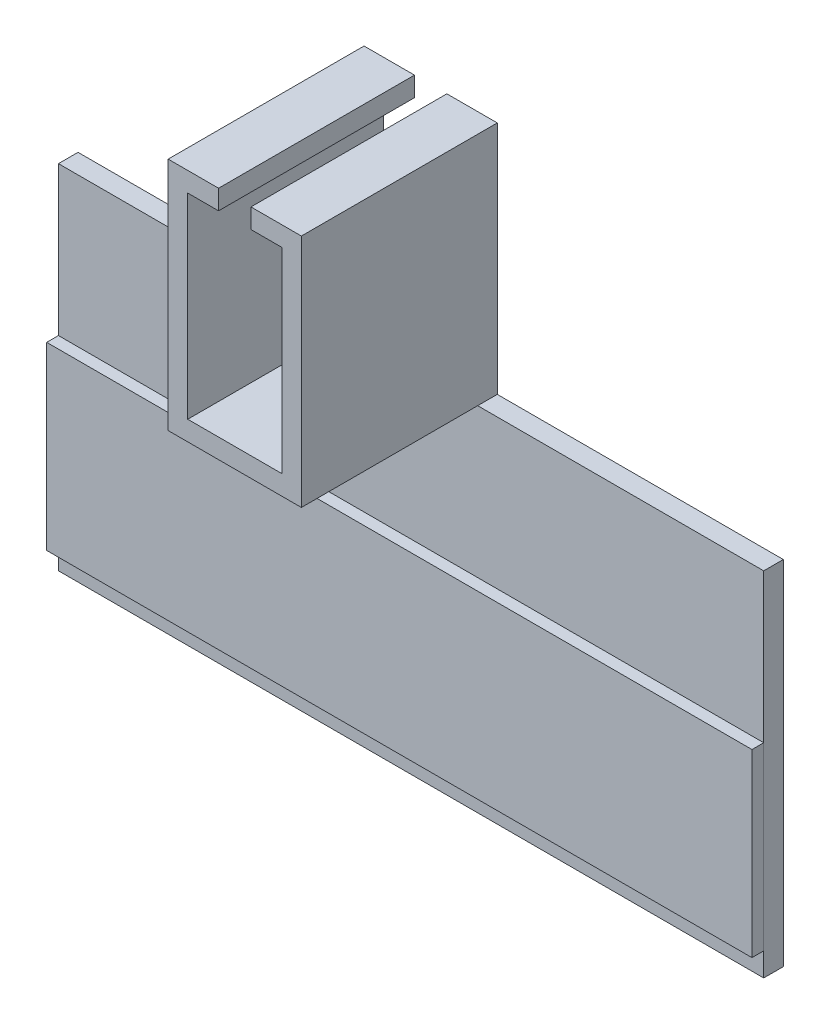
from build123d import *

# Parameters (mm, degrees)
AUFSATZ_LINEAR_AUSTRAGEN1_DEPTH = 500
SKIZZE2_W                       = 450
SKIZZE2_H                       = 900
SCHNITT_LINEAR_AUSTRAGEN1_DEPTH = 2096.829191513
SKIZZE3_W                       = 30
SKIZZE3_H                       = 460
AUFSATZ_LINEAR_AUSTRAGEN2_DEPTH = 1800


with BuildPart() as part:
    # Skizze1 → Aufsatz-Linear austragen1 (new body)
    with BuildSketch(Plane.XY):
        Polygon((-120, 0), (120, 0), (120, 500), (41.348314607, 500), (41.348314607, 550), (170, 550), (170, -50), (900, -50), (900, -950), (513.483146067, -950), (-513.483146067, -950), (-900, -950), (-900, -50), (-170, -50), (-170, 550), (-41.348314607, 550), (-41.348314607, 500), (-120, 500), align=None)
    extrude(amount=AUFSATZ_LINEAR_AUSTRAGEN1_DEPTH)

    # Skizze2 → Schnitt-Linear austragen1 (cut, through all)
    with BuildSketch(Plane(origin=(900, 0, 0), x_dir=(0, 0, -1), z_dir=(1, 0, 0))):
        with Locations((-275, -500)):
            Rectangle(SKIZZE2_W, SKIZZE2_H)
    extrude(amount=-SCHNITT_LINEAR_AUSTRAGEN1_DEPTH, mode=Mode.SUBTRACT)


with BuildPart() as body_2:
    # Skizze3 → Aufsatz-Linear austragen2 (new body)
    with BuildSketch(Plane(origin=(900, 0, 0), x_dir=(0, 0, -1), z_dir=(1, 0, 0))):
        with Locations((-65, -660)):
            Rectangle(SKIZZE3_W, SKIZZE3_H)
    extrude(amount=-AUFSATZ_LINEAR_AUSTRAGEN2_DEPTH)


solid = Compound([part.part, body_2.part])
